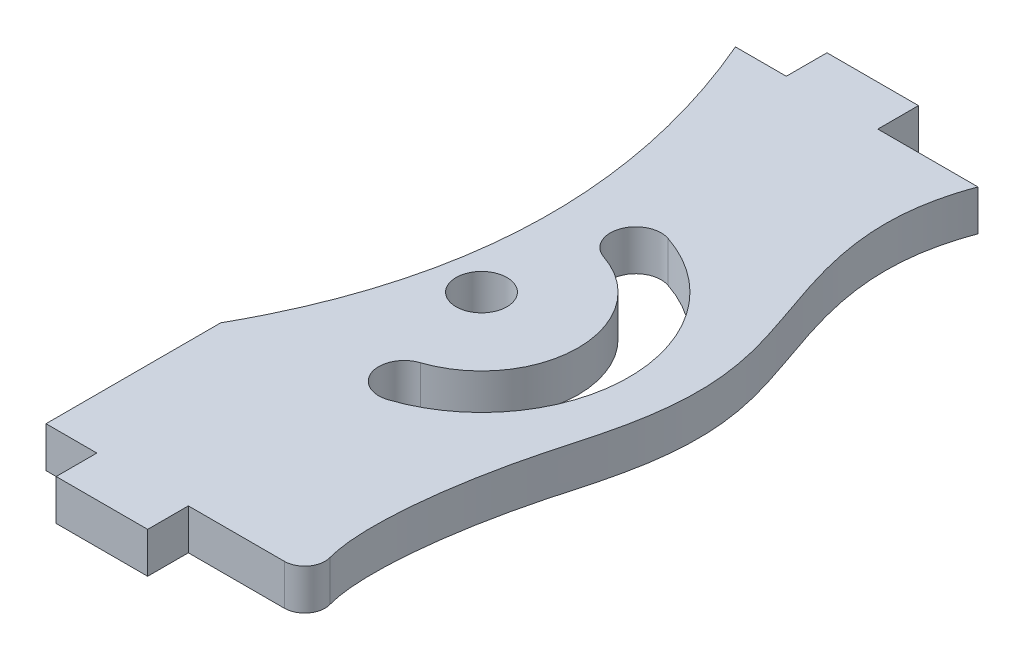
from build123d import *

# Parameters (mm, degrees)
CROQUIS1_R              = 1.25
SALIENTE_EXTRUIR1_DEPTH = 2


with BuildPart() as part:
    # Croquis1 → Saliente-Extruir1 (new body)
    with BuildSketch(Plane(origin=(0, 0, 0), x_dir=(1, 0, 0), z_dir=(0, 1, 0))):
        with BuildLine():
            Line((-1.70050822, 16.689223124), (-4.20050822, 16.689223124))
            add(Edge.make_bspline(
                [(-4.20050822, 16.689223124), (1.327651649, 3.755856275), (-5.106271418, -7.718861624)],
                knots=[0, 0, 0, 1, 1, 1], degree=2))
            Line((-5.106271418, -7.718861624), (-5.106271418, -16.310776876))
            Line((-5.106271418, -16.310776876), (-2.606271418, -16.310776876))
            Line((-2.606271418, -16.310776876), (-2.606271418, -18.310776876))
            Line((-2.606271418, -18.310776876), (1.893728582, -18.310776876))
            Line((1.893728582, -18.310776876), (1.893728582, -16.310776876))
            Line((1.893728582, -16.310776876), (6.615059029, -16.310776876))
            ThreePointArc((6.615059029, -16.310776876), (7.412164162, -15.914617423), (7.577707829, -15.040023689))
            add(Edge.make_bspline(
                [(7.577707829, -15.040023689), (7.009095125, -13.018350945), (7.479696929, -8.281838807), (9.837054162, -0.269934456), (9.506886296, 5.625743932), (5.899776863, 11.831578143), (7.726600223, 16.689223124)],
                knots=[0.078667813, 0.078667813, 0.078667813, 0.078667813, 0.337938342, 0.393992599, 0.639210385, 1, 1, 1, 1], degree=3))
            Line((7.726600223, 16.689223124), (2.79949178, 16.689223124))
            Line((2.79949178, 16.689223124), (2.79949178, 18.689223124))
            Line((2.79949178, 18.689223124), (-1.70050822, 18.689223124))
            Line((-1.70050822, 18.689223124), (-1.70050822, 16.689223124))
        make_face()
        Circle(CROQUIS1_R, mode=Mode.SUBTRACT)
        with BuildLine():
            ThreePointArc((2.286674037, 6.879943448), (7.25, 0), (2.286674037, -6.879943448))
            ThreePointArc((2.286674037, -6.879943448), (1.27490881, -6.780567383), (0.671607691, -5.962293444))
            ThreePointArc((0.671607691, -5.962293444), (0.805598812, -5.076235218), (1.498165749, -4.507549156))
            ThreePointArc((1.498165749, -4.507549156), (4.75, 0), (1.498165749, 4.507549156))
            ThreePointArc((1.498165749, 4.507549156), (0.805598812, 5.076235218), (0.671607691, 5.962293444))
            ThreePointArc((0.671607691, 5.962293444), (1.27490881, 6.780567383), (2.286674037, 6.879943448))
        make_face(mode=Mode.SUBTRACT)
    extrude(amount=SALIENTE_EXTRUIR1_DEPTH)


solid = part.part
